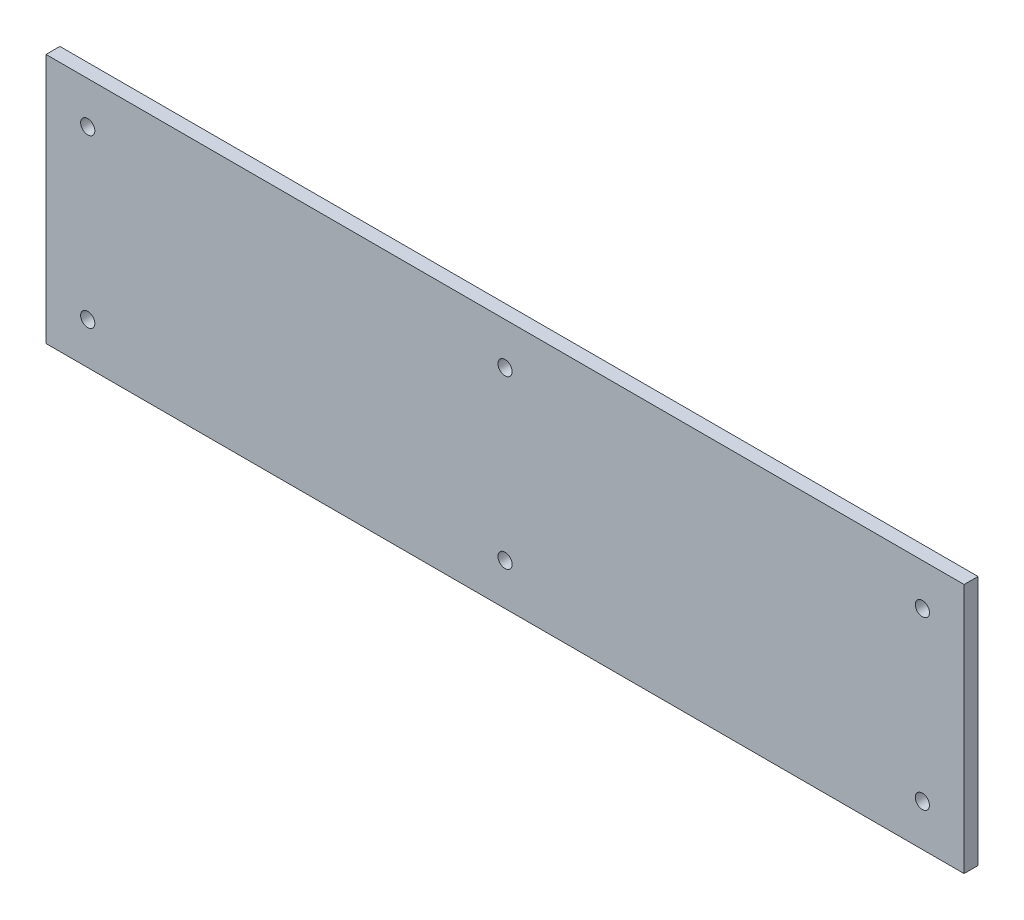
from build123d import *

# Parameters (mm, degrees)
SKETCH1_W           = 330
SKETCH1_H           = 90
BOSS_EXTRUDE1_DEPTH = 2.5
SKETCH2_R           = 2.55
CUT_EXTRUDE1_DEPTH  = 172.099386323


with BuildPart() as part:
    # Sketch1 → Boss-Extrude1 (new, symmetric)
    with BuildSketch(Plane.XY):
        Rectangle(SKETCH1_W, SKETCH1_H)
    extrude(amount=BOSS_EXTRUDE1_DEPTH, both=True)

    # Sketch2 → Cut-Extrude1 (cut, through all)
    with BuildSketch(Plane.XY.offset(2.5)):
        with Locations((150, 30)):
            Circle(SKETCH2_R)
        with Locations((150, -30)):
            Circle(SKETCH2_R)
        with Locations((0, 30)):
            Circle(SKETCH2_R)
        with Locations((0, -30)):
            Circle(SKETCH2_R)
        with Locations((-150, -30)):
            Circle(SKETCH2_R)
        with Locations((-150, 30)):
            Circle(SKETCH2_R)
    extrude(amount=-CUT_EXTRUDE1_DEPTH, mode=Mode.SUBTRACT)


solid = part.part
